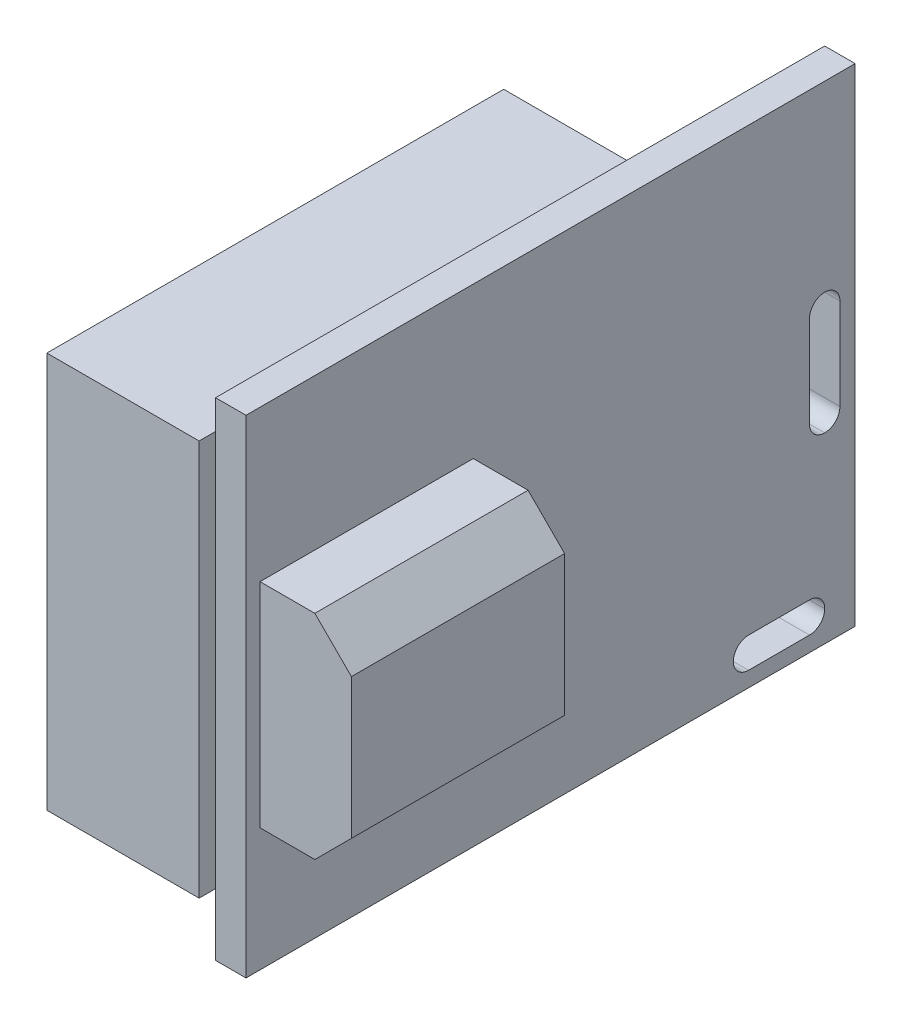
from build123d import *

# Parameters (mm, degrees)
SKETCH_1_W          = 1
SKETCH_1_H          = 16
EXTRUDE_1_DEPTH     = 20
SKETCH_1_3_W        = 5
SKETCH_1_3_H        = 13
EXTRUDE_2_DEPTH     = 15
SKETCH_1_4_W        = 3
SKETCH_1_4_H        = 7
EXTRUDE_3_DEPTH     = 7
SKETCH_2_W          = 1
SKETCH_2_H          = 4
SKETCH_2_W_2        = 3
SKETCH_2_H_2        = 1
CUT_EXTRUDE_1_DEPTH = 23.511320343
FILLET_1_R          = 0.5
CHAMFER_1_SIZE      = 1.2


with BuildPart() as part:
    # Эскиз1 → Бобышка-Вытянуть1 (new body)
    with BuildSketch(Plane.XY):
        with Locations((3.539078192, 0)):
            Rectangle(SKETCH_1_W, SKETCH_1_H)
    extrude(amount=-EXTRUDE_1_DEPTH)

    # Эскиз2 → Вырез-Вытянуть1 (cut, through all)
    with BuildSketch(Plane(origin=(4.039078192, 0, 0), x_dir=(0, 0, -1), z_dir=(1, 0, 0))):
        with Locations((19, 0)):
            Rectangle(SKETCH_2_W, SKETCH_2_H)
        with Locations((17.5, -7)):
            Rectangle(SKETCH_2_W_2, SKETCH_2_H_2)
    extrude(amount=-CUT_EXTRUDE_1_DEPTH, mode=Mode.SUBTRACT)

    # Скругление1
    fillet_1_edges = [part.edges().sort_by_distance(p)[0] for p in [
        (3.539078192, -2, -18.5),
        (3.539078192, 2, -18.5),
        (3.539078192, 2, -19.5),
        (3.539078192, -2, -19.5),
        (3.539078192, -7.5, -19),
        (3.539078192, -6.5, -19),
        (3.539078192, -6.5, -16),
        (3.539078192, -7.5, -16),
    ]]
    fillet(fillet_1_edges, radius=FILLET_1_R - 0.0001)  # a hair under: the kernel refuses the full size


with BuildPart() as body_2:
    # Эскиз1<3> → Бобышка-Вытянуть2 (new body)
    with BuildSketch(Plane.XY):
        Rectangle(SKETCH_1_3_W, SKETCH_1_3_H)
    extrude(amount=-EXTRUDE_2_DEPTH)


with BuildPart() as body_3:
    # Эскиз1<4> → Бобышка-Вытянуть3 (new body)
    with BuildSketch(Plane.XY):
        with Locations((6, 0)):
            Rectangle(SKETCH_1_4_W, SKETCH_1_4_H)
    extrude(amount=-EXTRUDE_3_DEPTH)

    # Фаска1
    chamfer_1_edges = [body_3.edges().sort_by_distance(p)[0] for p in [
        (7.5, -3.5, -3.5),
        (7.5, 3.5, -3.5),
    ]]
    chamfer(chamfer_1_edges, length=CHAMFER_1_SIZE)


solid = Compound([part.part, body_2.part, body_3.part])
